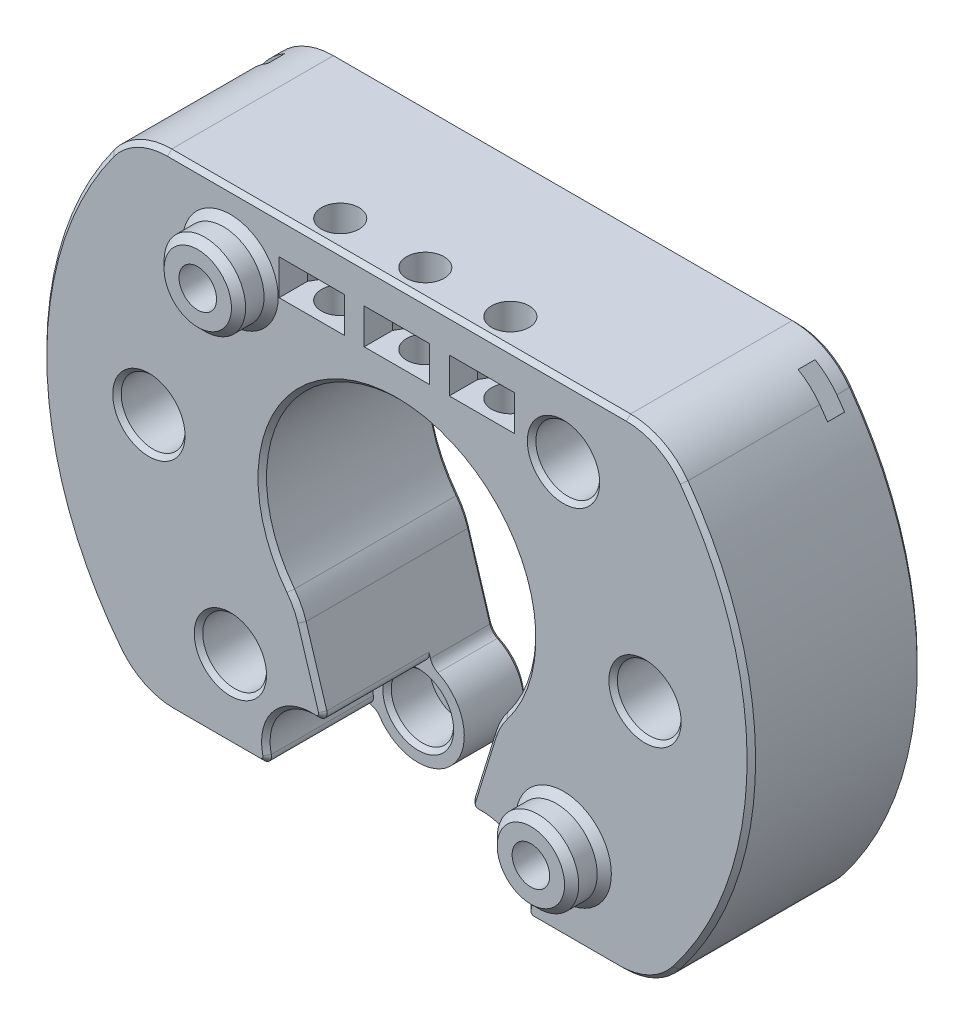
from build123d import *

# Parameters (mm, degrees)
SKIZZE1_R                            = 4.5
AUFSATZ_LINEAR_AUSTRAGEN1_DEPTH      = 24
SCHNITT_LINEAR_START                 = -15
SKIZZE2_R                            = 6.5
SCHNITT_LINEAR_AUSTRAGEN1_DEPTH      = 15
SKIZZE3_R                            = 4.4
SCHNITT_LINEAR_AUSTRAGEN2_DEPTH      = 6
AUFSATZ_LINEAR_AUSTRAGEN2_DEPTH      = 4.6
AUFSATZ_LINEAR_AUSTRAGEN2_DEPTH_BACK = 2
SKIZZE4_R                            = 5.75
SKIZZE4_R_2                          = 2.65
SCHNITT_LINEAR_START_2               = -5
SCHNITT_LINEAR_AUSTRAGEN6_DEPTH      = 5
SKIZZE9_R                            = 2.65
SCHNITT_LINEAR_AUSTRAGEN7_DEPTH      = 30
SKIZZE12_R                           = 1.65
SCHNITT_LINEAR_AUSTRAGEN9_DEPTH      = 16
SCHNITT_LINEAR_START_3               = -2.4
SCHNITT_LINEAR_AUSTRAGEN8_DEPTH      = 2.4
SCHNITT_LINEAR_AUSTRAGEN10_REACH     = 69.515
SKIZZE13_R                           = 4.5
FASE1_SIZE                           = 1
VERRUNDUNG1_R                        = 10
VERRUNDUNG2_R                        = 1
VERRUNDUNG4_R                        = 2
FASE2_SIZE                           = 0.6
FASE3_SIZE                           = 0.6


with BuildPart() as part:
    # Skizze1 → Aufsatz-Linear austragen1 (new body)
    with BuildSketch(Plane.XY):
        with BuildLine():
            Line((37.118054906, 33.5), (0, 33.5))
            Line((0, 33.5), (-37.118054906, 33.5))
            ThreePointArc((-37.118054906, 33.5), (-49.993282209, -0.819593803), (-36, -34.698703146))
            Line((-36, -34.698703146), (-17.913290229, -34.698703146))
            ThreePointArc((-17.913290229, -34.698703146), (-7.146445801, -36.323541562), (-10, -25.815341562))
            Line((-10, -25.815341562), (-14, -12.845232579))
            ThreePointArc((-14, -12.845232579), (-6.892024376, 17.70593121), (19, 0))
            ThreePointArc((19, 0), (17.70593121, -6.892024376), (14, -12.845232579))
            Line((14, -12.845232579), (10, -25.815341562))
            ThreePointArc((10, -25.815341562), (7.146445801, -36.323541562), (17.913290229, -34.698703146))
            Line((17.913290229, -34.698703146), (36, -34.698703146))
            ThreePointArc((36, -34.698703146), (49.993282209, -0.819593803), (37.118054906, 33.5))
        make_face()
        with Locations((-23.5, -23.5)):
            Circle(SKIZZE1_R, mode=Mode.SUBTRACT)
        with Locations((23.5, -23.5)):
            Circle(SKIZZE1_R, mode=Mode.SUBTRACT)
        with Locations((-23.5, 23.5)):
            Circle(SKIZZE1_R, mode=Mode.SUBTRACT)
        with Locations((23.5, 23.5)):
            Circle(SKIZZE1_R, mode=Mode.SUBTRACT)
    extrude(amount=AUFSATZ_LINEAR_AUSTRAGEN1_DEPTH)

    # Skizze2 → Schnitt-Linear austragen1 (cut)
    with BuildSketch(Plane.XY.offset(24).offset(SCHNITT_LINEAR_START)):
        with Locations((12, -32)):
            Circle(SKIZZE2_R)
        with Locations((-12, -32)):
            Circle(SKIZZE2_R)
    extrude(amount=SCHNITT_LINEAR_AUSTRAGEN1_DEPTH, mode=Mode.SUBTRACT)

    # Skizze3 → Schnitt-Linear austragen2 (cut)
    with BuildSketch(Plane.XY.offset(9)):
        with Locations((12, -32)):
            Circle(SKIZZE3_R)
        with Locations((-12, -32)):
            Circle(SKIZZE3_R)
    extrude(amount=-SCHNITT_LINEAR_AUSTRAGEN2_DEPTH, mode=Mode.SUBTRACT)

    # Skizze4 → Aufsatz-Linear austragen2 (add, two sides: drawn at the far end of the back side and taken through both)
    # profile 1 of 2: a face of its own
    with BuildSketch(Plane.XY.offset(24).offset(-AUFSATZ_LINEAR_AUSTRAGEN2_DEPTH_BACK)):
        with Locations((-23.5, 23.5)):
            Circle(SKIZZE4_R)
        with Locations((-23.5, 23.5)):
            Circle(SKIZZE4_R_2, mode=Mode.SUBTRACT)
    # profile 2 of 2: a face of its own
    with BuildSketch(Plane.XY.offset(24).offset(-AUFSATZ_LINEAR_AUSTRAGEN2_DEPTH_BACK)):
        with Locations((23.5, -23.5)):
            Circle(SKIZZE4_R)
        with Locations((23.5, -23.5)):
            Circle(SKIZZE4_R_2, mode=Mode.SUBTRACT)
    extrude(amount=AUFSATZ_LINEAR_AUSTRAGEN2_DEPTH + AUFSATZ_LINEAR_AUSTRAGEN2_DEPTH_BACK)

    # Skizze8 → Schnitt-Linear austragen6 (cut)
    with BuildSketch(Plane(origin=(0, 33.5, 0), x_dir=(1, 0, 0), z_dir=(0, 1, 0)).offset(SCHNITT_LINEAR_START_2)):
        Polygon((4.618802154, -20), (2.309401077, -16), (-2.309401077, -16), (-4.618802154, -20), (-4.618802154, -24), (4.618802154, -24), align=None)
        Polygon((16.618802154, -20), (14.309401077, -16), (9.690598923, -16), (7.381197846, -20), (7.381197846, -24), (16.618802154, -24), align=None)
        Polygon((-7.381197846, -20), (-9.690598923, -16), (-14.309401077, -16), (-16.618802154, -20), (-16.618802154, -24), (-7.381197846, -24), align=None)
    extrude(amount=-SCHNITT_LINEAR_AUSTRAGEN6_DEPTH, mode=Mode.SUBTRACT)

    # Skizze9 → Schnitt-Linear austragen7 (cut)
    with BuildSketch(Plane(origin=(0, 33.5, 0), x_dir=(1, 0, 0), z_dir=(0, 1, 0))):
        with Locations(Location((-12, -20, 0), (0, 0, 180))):
            Circle(SKIZZE9_R)
        with Locations(Location((0, -20, 0), (0, 0, 180))):
            Circle(SKIZZE9_R)
        with Locations(Location((12, -20, 0), (0, 0, 180))):
            Circle(SKIZZE9_R)
    extrude(amount=-SCHNITT_LINEAR_AUSTRAGEN7_DEPTH, mode=Mode.SUBTRACT)

    # Skizze12 → Schnitt-Linear austragen9 (cut)
    with BuildSketch(Plane(origin=(0, 0, 0), x_dir=(-1, 0, 0), z_dir=(0, 0, -1))):
        with Locations((-35, 25.5)):
            Circle(SKIZZE12_R)
        with Locations(Location((35, 25.5, 0), (0, 0, 180))):
            Circle(SKIZZE12_R)
    extrude(amount=-SCHNITT_LINEAR_AUSTRAGEN9_DEPTH, mode=Mode.SUBTRACT)

    # Skizze11 → Schnitt-Linear austragen8 (cut)
    with BuildSketch(Plane(origin=(0, 0, 0), x_dir=(-1, 0, 0), z_dir=(0, 0, -1)).offset(SCHNITT_LINEAR_START_3)):
        Polygon((-44.899494937, 39.642135624), (-30.757359313, 25.5), (-35, 21.257359313), (-49.142135624, 35.399494937), align=None)
        Polygon((44.899494937, 39.642135624), (49.142135624, 35.399494937), (35, 21.257359313), (30.757359313, 25.5), align=None)
    extrude(amount=-SCHNITT_LINEAR_AUSTRAGEN8_DEPTH, mode=Mode.SUBTRACT)

    # Skizze13 → Schnitt-Linear austragen10 (cut, up to next)
    with BuildSketch(Plane.XY.offset(24), mode=Mode.PRIVATE) as schnitt_linear_austragen10_sk1:
        with Locations((35, 0)):
            Circle(SKIZZE13_R)
    schnitt_linear_austragen10_tool1 = extrude(schnitt_linear_austragen10_sk1.sketch, amount=-SCHNITT_LINEAR_AUSTRAGEN10_REACH, mode=Mode.PRIVATE) & part.part
    # Skizze13 → Schnitt-Linear austragen10 (cut, up to next)
    with BuildSketch(Plane.XY.offset(24), mode=Mode.PRIVATE) as schnitt_linear_austragen10_sk2:
        with Locations((-35, 0)):
            Circle(SKIZZE13_R)
    schnitt_linear_austragen10_tool2 = extrude(schnitt_linear_austragen10_sk2.sketch, amount=-SCHNITT_LINEAR_AUSTRAGEN10_REACH, mode=Mode.PRIVATE) & part.part
    add(schnitt_linear_austragen10_tool1.solids().sort_by_distance((35, 0, 24))[0], mode=Mode.SUBTRACT)
    add(schnitt_linear_austragen10_tool2.solids().sort_by_distance((-35, 0, 24))[0], mode=Mode.SUBTRACT)

    # Fase1
    fase1_edges = [part.edges().sort_by_distance(p)[0] for p in [
        (-29.25, 23.5, 24),
        (-29.25, 23.5, 28.6),
        (17.75, -23.5, 24),
        (17.75, -23.5, 28.6),
    ]]
    chamfer(fase1_edges, length=FASE1_SIZE)

    # Verrundung1
    # the kernel refuses this fillet: 10 mm, written as the material it takes off along each edge
    with BuildSketch(Plane(origin=(-37.118054906, 33.5, -13.2741053), x_dir=(1, 0, 0), z_dir=(0, 0, 1))) as verrundung1_piece_1:
        with BuildLine():
            CenterArc((4.749088287, -10), VERRUNDUNG1_R, 90, 54.020199403)
            ThreePointArc((-3.343153368, -4.125), (-1.726371015, -2.018091308), (0, 0))
            Line((0, 0), (4.749088287, 0))
        make_face()
    extrude(amount=50.5482106, mode=Mode.SUBTRACT)
    with BuildSketch(Plane(origin=(37.118054906, 33.5, -13.2741053), x_dir=(0.6296381738302621, -0.7768885184218471, 0), z_dir=(0, 0, 1))) as verrundung1_piece_2:
        with BuildLine():
            CenterArc((4.778677908, -9.985893901), VERRUNDUNG1_R, 86.956367897, 54.020199403)
            Line((-2.990207276, -3.689512163), (0, 0))
            ThreePointArc((0, 0), (2.65482106, 0.070530494), (5.30964212, 0))
        make_face()
    extrude(amount=50.5482106, mode=Mode.SUBTRACT)
    with BuildSketch(Plane(origin=(36, -34.698703146, -12.678915541), x_dir=(-1, 0, 0), z_dir=(0, 0, 1))) as verrundung1_piece_3:
        with BuildLine():
            CenterArc((4.536146725, -10), VERRUNDUNG1_R, 90, 51.86856143)
            ThreePointArc((-3.329816594, -3.825324214), (-1.713440487, -1.870416461), (0, 0))
            Line((0, 0), (4.536146725, 0))
        make_face()
    extrude(amount=49.357831082, mode=Mode.SUBTRACT)
    with BuildSketch(Plane(origin=(-36, -34.698703146, -12.678915541), x_dir=(1, 0, 0), z_dir=(0, 0, 1))) as verrundung1_piece_4:
        with BuildLine():
            CenterArc((4.536146725, 10), VERRUNDUNG1_R, 218.13143857, 51.86856143)
            ThreePointArc((-3.329816594, 3.825324214), (-1.713440487, 1.870416461), (0, 0))
            Line((0, 0), (4.536146725, 0))
        make_face()
    extrude(amount=49.357831082, mode=Mode.SUBTRACT)
    with BuildSketch(Plane(origin=(14, -12.845232579, -5.015844183), x_dir=(0.6439572066482543, 0.7650615112563025, 0), z_dir=(0, 0, 1))) as verrundung1_piece_5:
        with BuildLine():
            CenterArc((2.051348605, -9.990863815), VERRUNDUNG1_R, 92.449363001, 20.498335634)
            Line((-1.8475584, -0.782252401), (0, 0))
            ThreePointArc((0, 0), (0.811992156, -0.017358752), (1.623984312, 0))
        make_face()
    extrude(amount=34.031688366, mode=Mode.SUBTRACT)
    with BuildSketch(Plane(origin=(-14, -12.845232579, -5.015844183), x_dir=(-0.6439572066482535, 0.7650615112563031, 0), z_dir=(0, 0, 1))) as verrundung1_piece_6:
        with BuildLine():
            CenterArc((2.051348605, 9.990863815), VERRUNDUNG1_R, 247.052301364, 20.498335634)
            Line((-1.8475584, 0.782252401), (0, 0))
            ThreePointArc((0, 0), (0.811992156, 0.017358752), (1.623984312, 0))
        make_face()
    extrude(amount=34.031688366, mode=Mode.SUBTRACT)

    # Verrundung2
    verrundung2_edges = [part.edges().sort_by_distance(p)[0] for p in [
        (-10, -25.815341562, 16.5),
        (-17.913290229, -34.698703146, 16.5),
        (17.913290229, -34.698703146, 16.5),
        (10, -25.815341562, 16.5),
    ]]
    fillet(verrundung2_edges, radius=VERRUNDUNG2_R)

    # Verrundung4
    verrundung4_edges = [part.edges().sort_by_distance(p)[0] for p in [
        (-10, -25.815341562, 4.5),
        (-17.913290229, -34.698703146, 4.5),
        (17.913290229, -34.698703146, 4.5),
        (10, -25.815341562, 4.5),
    ]]
    fillet(verrundung4_edges, radius=VERRUNDUNG4_R)

    # Fase2
    fase2_edges = [part.edges().sort_by_distance(p)[0] for p in [
        (-28, -23.5, 24),
        (19, 23.5, 24),
        (30.5, 0, 24),
        (-39.5, 0, 24),
        (11.949469972, -19.494132062, 24),
        (-6.129039418, 17.984295255, 24),
        (25.384473955, -34.698703146, 24),
        (49.991186257, -0.938774009, 24),
        (0, 33.5, 24),
        (-49.991186257, -0.938774009, 24),
        (-11.949469972, -19.494132062, 24),
        (-35.837252533, -33.691665891, 24),
        (35.837252533, -33.691665891, 24),
        (36.91044215, 32.409264841, 24),
        (-36.91044215, 32.409264841, 24),
        (-14.085569243, -13.109219485, 24),
        (14.085569243, -13.109219485, 24),
        (-16.937224442, -27.772256535, 24),
        (-25.384473955, -34.698703146, 24),
        (16.937224442, -27.772256535, 24),
        (10.663728828, -25.14368551, 24),
        (18.521993826, -34.320597931, 24),
        (-10.663728828, -25.14368551, 24),
        (-18.521993826, -34.320597931, 24),
        (7.6, -32, 9),
        (-16.4, -32, 9),
    ]]
    chamfer(fase2_edges, length=FASE2_SIZE)

    # Fase3
    fase3_edges = [part.edges().sort_by_distance(p)[0] for p in [
        (36.65, 25.5, 0),
        (-36.65, 25.5, 0),
        (-28, 23.5, 0),
        (30.5, 0, 0),
        (-39.5, 0, 0),
        (19, 23.5, 0),
        (19, -23.5, 0),
        (-28, -23.5, 0),
        (11.84496981, -19.832976684, 0),
        (-6.129039418, 17.984295255, 0),
        (-11.84496981, -19.832976684, 0),
        (-49.991186257, -0.938774009, 0),
        (0, 33.5, 0),
        (49.991186257, -0.938774009, 0),
        (25.273543103, -34.698703146, 0),
        (-35.837252533, -33.691665891, 0),
        (35.837252533, -33.691665891, 0),
        (36.91044215, 32.409264841, 0),
        (-36.91044215, 32.409264841, 0),
        (-14.085569243, -13.109219485, 0),
        (14.085569243, -13.109219485, 0),
        (7.08406475, -36.252479349, 0),
        (-7.08406475, -36.252479349, 0),
        (-25.273543103, -34.698703146, 0),
        (18.137493649, -34.93643835, 0),
        (9.881071805, -25.624339235, 0),
        (-9.881071805, -25.624339235, 0),
        (-18.137493649, -34.93643835, 0),
    ]]
    chamfer(fase3_edges, length=FASE3_SIZE)


solid = part.part
